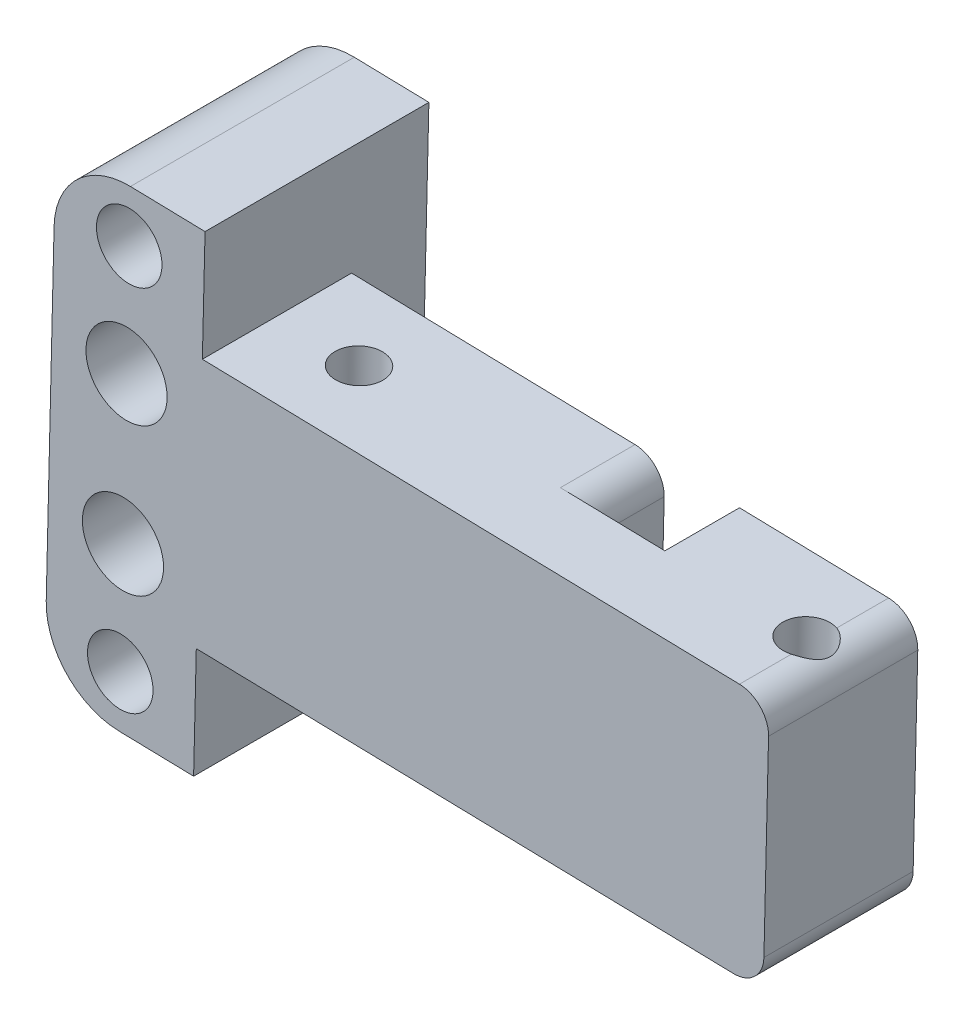
from build123d import *

# Parameters (mm, degrees)
EXTRUDE_1_DEPTH     = 15
CUT_EXTRUDE_1_DEPTH = 5
SKETCH_3_R          = 1.6
SKETCH_3_W          = 5
SKETCH_3_H          = 5
CUT_EXTRUDE_2_DEPTH = 22
FILLET_1_R          = 2


with BuildPart() as part:
    # 草图1 → 凸台-拉伸1 (new body)
    with BuildSketch(Plane.XY):
        with BuildLine():
            Line((24.185160084, -7.016301696), (24.496510845, 5.979969335))
            ThreePointArc((24.496510845, 5.979969335), (23.944762934, 7.407806858), (22.544984649, 8.027295764))
            Line((22.544984649, 8.027295764), (-13.444688974, 8.889497871))
            Line((-13.444688974, 8.889497871), (-13.265063535, 16.387346543))
            Line((-13.265063535, 16.387346543), (-18.263629316, 16.507096835))
            ThreePointArc((-18.263629316, 16.507096835), (-21.833223125, 15.127727058), (-23.38194539, 11.628281347))
            Line((-23.38194539, 11.628281347), (-23.908846678, -10.36540809))
            ThreePointArc((-23.908846678, -10.36540809), (-22.5294769, -13.935001898), (-19.030031189, -15.483724163))
            Line((-19.030031189, -15.483724163), (-14.031465408, -15.603474456))
            Line((-14.031465408, -15.603474456), (-13.851839969, -8.105625784))
            Line((-13.851839969, -8.105625784), (22.137833654, -8.967827891))
            ThreePointArc((22.137833654, -8.967827891), (23.565671178, -8.41607998), (24.185160084, -7.016301696))
        make_face()
        with BuildLine():
            ThreePointArc((-16.75044735, -12.037331753), (-18.893602347, -9.788969482), (-21.141964619, -11.93212448))
            ThreePointArc((-21.141964619, -11.93212448), (-18.998809621, -14.180486751), (-16.75044735, -12.037331753))
        make_face(mode=Mode.SUBTRACT)
        with BuildLine():
            ThreePointArc((-16.04728092, -4.552025517), (-18.701434473, -1.76757982), (-21.48588017, -4.421733373))
            ThreePointArc((-21.48588017, -4.421733373), (-18.831726617, -7.20617907), (-16.04728092, -4.552025517))
        make_face(mode=Mode.SUBTRACT)
        with BuildLine():
            ThreePointArc((-15.807780335, 5.445106045), (-18.461933888, 8.229551742), (-21.246379585, 5.575398189))
            ThreePointArc((-21.246379585, 5.575398189), (-18.592226032, 2.790952492), (-15.807780335, 5.445106045))
        make_face(mode=Mode.SUBTRACT)
        with BuildLine():
            ThreePointArc((-16.151695887, 12.955497152), (-18.294850884, 15.203859423), (-20.543213156, 13.060704426))
            ThreePointArc((-20.543213156, 13.060704426), (-18.400058158, 10.812342154), (-16.151695887, 12.955497152))
        make_face(mode=Mode.SUBTRACT)
    extrude(amount=-EXTRUDE_1_DEPTH)

    # 草图2 → 切除-拉伸1 (cut)
    with BuildSketch(Plane(origin=(0, 0, -15), x_dir=(-1, 0, 0), z_dir=(0, 0, -1))):
        Polygon((13.444688974, 8.889497871), (13.851839969, -8.105625784), (-33.415838559, -15.121344773), (-27.379501609, 15.743180277), align=None)
    extrude(amount=-CUT_EXTRUDE_1_DEPTH, mode=Mode.SUBTRACT)

    # 草图3 → 切除-拉伸2 (cut)
    with BuildSketch(Plane(origin=(0.205130979, 8.562490084, 0), x_dir=(0.9997131562086496, -0.02395005852477245, 0), z_dir=(0.02395005852477245, 0.9997131562086496, 0))):
        with Locations((21.846263557, 5)):
            Circle(SKETCH_3_R)
        with Locations((-8.153736443, 5)):
            Circle(SKETCH_3_R)
        with Locations((9.846263557, 7.5)):
            Rectangle(SKETCH_3_W, SKETCH_3_H)
    extrude(amount=-CUT_EXTRUDE_2_DEPTH, mode=Mode.SUBTRACT)

    # 圆角1
    fillet_1_edges = [part.edges().sort_by_distance(p)[0] for p in [
        (7.142136311, -8.608577013, -7.5),
        (7.549287306, 8.386546642, -7.5),
    ]]
    fillet(fillet_1_edges, radius=FILLET_1_R)


solid = part.part
